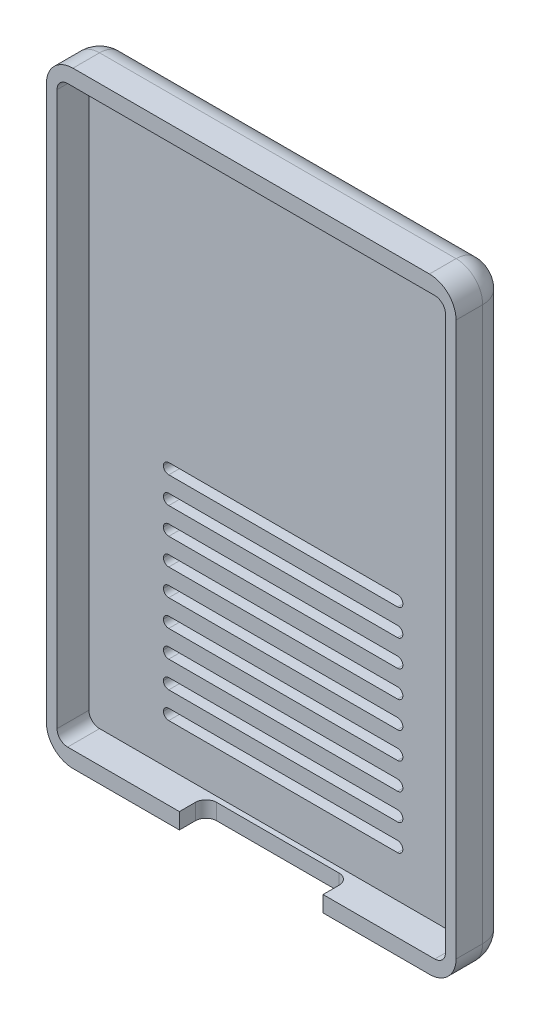
from build123d import *

# Parameters (mm, degrees)
SKETCH5_W           = 77
SKETCH5_H           = 114
BOSS_EXTRUDE3_DEPTH = 10
SKETCH7_W           = 73
SKETCH7_H           = 108
CUT_EXTRUDE5_DEPTH  = 6
FILLET3_R           = 5
FILLET4_R           = 5
FILLET5_R           = 2
SKETCH8_W           = 27
SKETCH8_H           = 5
CUT_EXTRUDE6_DEPTH  = 6
FILLET6_R           = 2
CUT_EXTRUDE7_DEPTH  = 1
SKETCH10_W          = 45
SKETCH10_H          = 2
CUT_EXTRUDE8_DEPTH  = 10
FILLET7_R           = 1


# Some blends are built 0.0001 mm under size
with BuildPart() as part:
    # Sketch5 → Boss-Extrude3 (new body)
    with BuildSketch(Plane.XY):
        with Locations((38.5, 53.537037037)):
            Rectangle(SKETCH5_W, SKETCH5_H)
    extrude(amount=BOSS_EXTRUDE3_DEPTH)

    # Sketch7 → Cut-Extrude5 (cut)
    with BuildSketch(Plane.XY.offset(10)):
        with Locations((38.5, 53.537037037)):
            Rectangle(SKETCH7_W, SKETCH7_H)
    extrude(amount=-CUT_EXTRUDE5_DEPTH, mode=Mode.SUBTRACT)

    # Fillet3
    fillet3_edges = [part.edges().sort_by_distance(p)[0] for p in [
        (38.5, 110.537037037, 0),
        (77, 53.537037037, 0),
        (38.5, -3.462962963, 0),
        (0, 53.537037037, 0),
    ]]
    fillet(fillet3_edges, radius=FILLET3_R)

    # Fillet4
    # the kernel refuses this fillet: 5 mm, written as the material it takes off along each edge
    with BuildSketch(Plane(origin=(5, 105.537037037, 5), x_dir=(-1, 0, 0), z_dir=(0, 1, 0))) as fillet4_piece_1_section:
        Polygon((0, 0), (FILLET4_R, 0), (FILLET4_R, -FILLET4_R), (0, -FILLET4_R), align=None)
    fillet4_piece_1 = extrude(amount=FILLET4_R, mode=Mode.PRIVATE)
    fillet4_piece_1 = fillet4_piece_1 - Plane(origin=(5, 105.537037037, 5), x_dir=(0.7071067811865475, 0, 0.7071067811865475), z_dir=(0, 1, 0)) * Sphere(FILLET4_R, mode=Mode.PRIVATE)
    add(fillet4_piece_1, mode=Mode.SUBTRACT)
    with BuildSketch(Plane(origin=(72, 105.537037037, 5), x_dir=(1, 0, 0), z_dir=(0, 1, 0))) as fillet4_piece_2_section:
        Polygon((0, 0), (FILLET4_R, 0), (FILLET4_R, FILLET4_R), (0, FILLET4_R), align=None)
    fillet4_piece_2 = extrude(amount=FILLET4_R, mode=Mode.PRIVATE)
    fillet4_piece_2 = fillet4_piece_2 - Plane(origin=(72, 105.537037037, 5), x_dir=(-0.7071067811865475, 0, 0.7071067811865475), z_dir=(0, 1, 0)) * Sphere(FILLET4_R, mode=Mode.PRIVATE)
    add(fillet4_piece_2, mode=Mode.SUBTRACT)
    with BuildSketch(Plane(origin=(5, 1.537037037, 5), x_dir=(0, -1, 0), z_dir=(-1, 0, 0))) as fillet4_piece_3_section:
        Polygon((0, 0), (FILLET4_R, 0), (FILLET4_R, -FILLET4_R), (0, -FILLET4_R), align=None)
    fillet4_piece_3 = extrude(amount=FILLET4_R, mode=Mode.PRIVATE)
    fillet4_piece_3 = fillet4_piece_3 - Plane(origin=(5, 1.537037037, 5), x_dir=(0, 0.7071067811865475, 0.7071067811865475), z_dir=(-1, 0, 0)) * Sphere(FILLET4_R, mode=Mode.PRIVATE)
    add(fillet4_piece_3, mode=Mode.SUBTRACT)
    with BuildSketch(Plane(origin=(72, 1.537037037, 5), x_dir=(0, -1, 0), z_dir=(1, 0, 0))) as fillet4_piece_4_section:
        Polygon((0, 0), (FILLET4_R, 0), (FILLET4_R, FILLET4_R), (0, FILLET4_R), align=None)
    fillet4_piece_4 = extrude(amount=FILLET4_R, mode=Mode.PRIVATE)
    fillet4_piece_4 = fillet4_piece_4 - Plane(origin=(72, 1.537037037, 5), x_dir=(0, 0.7071067811865475, 0.7071067811865475), z_dir=(1, 0, 0)) * Sphere(FILLET4_R, mode=Mode.PRIVATE)
    add(fillet4_piece_4, mode=Mode.SUBTRACT)
    with BuildSketch(Plane(origin=(0, 110.537037037, 5), x_dir=(1, 0, 0), z_dir=(0, 0, 1)), Plane(origin=(0, -3.462962963, 5), x_dir=(0, 1, 0), z_dir=(0, 0, 1))) as fillet4_piece_5:
        with BuildLine():
            CenterArc((FILLET4_R, -FILLET4_R), FILLET4_R, 90, 90)
            Line((0, -FILLET4_R), (0, 0))
            Line((0, 0), (FILLET4_R, 0))
        make_face()
    extrude(amount=17.5, mode=Mode.SUBTRACT)
    with BuildSketch(Plane(origin=(77, 110.537037037, 5), x_dir=(-1, 0, 0), z_dir=(0, 0, 1)), Plane(origin=(77, -3.462962963, 5), x_dir=(0, 1, 0), z_dir=(0, 0, 1))) as fillet4_piece_6:
        with BuildLine():
            CenterArc((FILLET4_R, FILLET4_R), FILLET4_R, 180, 90)
            Line((0, FILLET4_R), (0, 0))
            Line((0, 0), (FILLET4_R, 0))
        make_face()
    extrude(amount=17.5, mode=Mode.SUBTRACT)

    # Fillet5
    fillet5_edges = [part.edges().sort_by_distance(p)[0] for p in [
        (2, -0.462962963, 7),
        (2, 107.537037037, 7),
        (75, 107.537037037, 7),
        (75, -0.462962963, 7),
    ]]
    fillet(fillet5_edges, radius=FILLET5_R)

    # Sketch8 → Cut-Extrude6 (cut)
    with BuildSketch(Plane.XZ.offset(3.462962963)):
        with Locations((38.5, 7.5)):
            Rectangle(SKETCH8_W, SKETCH8_H)
    extrude(amount=-CUT_EXTRUDE6_DEPTH, mode=Mode.SUBTRACT)

    # Fillet6
    fillet6_edges = [part.edges().sort_by_distance(p)[0] for p in [
        (52, -1.962962963, 5),
        (25, -1.962962963, 5),
    ]]
    fillet(fillet6_edges, radius=FILLET6_R)

    # Sketch9 → Cut-Extrude7 (cut)
    # profile 1 of 10: a face of its own
    with BuildSketch(Plane(origin=(0, 0, 0), x_dir=(-1, 0, 0), z_dir=(0, 0, -1))):
        with BuildLine():
            Line((-53.6891973, 69.235203081), (-53.053179672, 69.235203081))
            add(Edge.make_bspline(
                [(-53.053179672, 69.235203081), (-53.011623105, 69.235017065), (-52.931451777, 69.234658201), (-52.815838126, 69.230306499), (-52.709178872, 69.222507983), (-52.611498521, 69.21287025), (-52.522837235, 69.199358525), (-52.443083984, 69.183868389), (-52.372222217, 69.164996895), (-52.309452864, 69.142596694), (-52.253119396, 69.116187732), (-52.199809767, 69.088060302), (-52.150728779, 69.054491206), (-52.103399167, 69.019098379), (-52.060526846, 68.978500759), (-52.019437185, 68.935400174), (-51.981870442, 68.888087292), (-51.947652548, 68.837134823), (-51.916611645, 68.783484149), (-51.889492235, 68.72703936), (-51.867494489, 68.667711138), (-51.849041115, 68.605883268), (-51.834219186, 68.541558446), (-51.824353238, 68.474341068), (-51.817651789, 68.404700471), (-51.817060479, 68.357303037), (-51.816761403, 68.333330084)],
                knots=[0, 0, 0, 0, 1.698747864, 3.27724071, 4.728299578, 6.070144658, 7.288476769, 8.393259625, 9.389771311, 10.283485332, 11.113357557, 11.931608583, 12.74405601, 13.541433047, 14.344816069, 15.154114104, 15.974336324, 16.810834471, 17.661136416, 18.50621059, 19.367396281, 20.244825668, 21.142564693, 22.063065223, 23.020325768, 24, 24, 24, 24], degree=3))
            add(Edge.make_bspline(
                [(-51.816761403, 68.333330084), (-51.817194129, 68.306809378), (-51.818044489, 68.254692931), (-51.826380756, 68.178296614), (-51.840621735, 68.105459642), (-51.85923395, 68.035567769), (-51.885187359, 67.96977087), (-51.914837911, 67.906499012), (-51.951317494, 67.847526143), (-51.99300125, 67.792114583), (-52.038524666, 67.739813811), (-52.088968468, 67.692133912), (-52.143371174, 67.648749854), (-52.201417867, 67.609206969), (-52.263326471, 67.573585023), (-52.329052316, 67.541550455), (-52.399044216, 67.51412783), (-52.447784469, 67.499786019), (-52.472495577, 67.49251478)],
                knots=[0, 0, 0, 0, 1.102006807, 2.165578795, 3.188629044, 4.184801286, 5.166646146, 6.124351954, 7.085497154, 8.042432466, 9.003981491, 9.963833307, 10.922997304, 11.89326795, 12.880200226, 13.889073926, 14.929769137, 16, 16, 16, 16], degree=3))
            add(Edge.make_bspline(
                [(-52.472495577, 67.49251478), (-52.488771735, 67.488465246), (-52.524031133, 67.47969265), (-52.582375753, 67.470786264), (-52.649611802, 67.46259739), (-52.725956697, 67.455560043), (-52.811454454, 67.450776288), (-52.906022288, 67.447040387), (-53.009703056, 67.444324002), (-53.081798562, 67.444227612), (-53.119325505, 67.44417744)],
                knots=[0, 0, 0, 0, 0.618981996, 1.340914327, 2.176866532, 3.120127938, 4.170906482, 5.338178032, 6.614476169, 8, 8, 8, 8], degree=3))
            Line((-53.119325505, 67.44417744), (-53.119325505, 66.060203081))
            Line((-53.119325505, 66.060203081), (-53.6891973, 66.060203081))
            Line((-53.6891973, 66.060203081), (-53.6891973, 69.235203081))
        make_face()
        with BuildLine():
            Line((-53.119325505, 68.014049235), (-52.917707917, 68.014049235))
            add(Edge.make_bspline(
                [(-52.917707917, 68.014049235), (-52.881020414, 68.014281862), (-52.813514863, 68.0147099), (-52.721326119, 68.020899572), (-52.64724147, 68.030352452), (-52.588713223, 68.043910068), (-52.542499627, 68.064485546), (-52.502643295, 68.088287498), (-52.468457501, 68.118384414), (-52.438857635, 68.15277529), (-52.415193434, 68.192292131), (-52.398783543, 68.23629148), (-52.388124001, 68.283848866), (-52.387139493, 68.316945658), (-52.386633198, 68.333966102)],
                knots=[0, 0, 0, 0, 1.8619151, 3.425951444, 4.686033666, 5.651700536, 6.461346321, 7.243864085, 7.999046032, 8.762387399, 9.539336099, 10.322741239, 11.137448474, 12, 12, 12, 12], degree=3))
            add(Edge.make_bspline(
                [(-52.386633198, 68.333966102), (-52.387134285, 68.348836642), (-52.388106516, 68.377689066), (-52.395248785, 68.41933027), (-52.406631508, 68.458148462), (-52.423124637, 68.493738237), (-52.444446346, 68.526039124), (-52.470441825, 68.555038397), (-52.5007775, 68.581357101), (-52.524198415, 68.595287993), (-52.53609734, 68.602365541)],
                knots=[0, 0, 0, 0, 1.102301479, 2.1387299, 3.123554645, 4.094223062, 5.036071848, 5.982632524, 6.975082478, 8, 8, 8, 8], degree=3))
            add(Edge.make_bspline(
                [(-52.53609734, 68.602365541), (-52.546176417, 68.607462819), (-52.567515889, 68.618254802), (-52.603859077, 68.630801271), (-52.645798562, 68.641385599), (-52.693617481, 68.65017049), (-52.747125072, 68.656988477), (-52.806311788, 68.662202532), (-52.871264727, 68.664299306), (-52.91643561, 68.664977805), (-52.939968534, 68.665331286)],
                knots=[0, 0, 0, 0, 0.656809284, 1.390599849, 2.23162475, 3.173112763, 4.218524733, 5.370385145, 6.63003504, 8, 8, 8, 8], degree=3))
            Line((-52.939968534, 68.665331286), (-53.119325505, 68.665331286))
            Line((-53.119325505, 68.665331286), (-53.119325505, 68.014049235))
        make_face(mode=Mode.SUBTRACT)
    # profile 2 of 10: a face of its own
    with BuildSketch(Plane(origin=(0, 0, 0), x_dir=(-1, 0, 0), z_dir=(0, 0, -1))):
        with BuildLine():
            add(Edge.make_bspline(
                [(-49.754792252, 69.316613338), (-49.699590986, 69.315184078), (-49.590611184, 69.312362396), (-49.430341221, 69.288841472), (-49.275891479, 69.250517499), (-49.127331798, 69.197244404), (-48.985034155, 69.127579282), (-48.848496618, 69.043497184), (-48.718208259, 68.943411112), (-48.595504168, 68.829655907), (-48.482103458, 68.705952089), (-48.383841676, 68.572762936), (-48.300047633, 68.433539513), (-48.230598907, 68.287908767), (-48.177700775, 68.134862135), (-48.140579967, 67.975179953), (-48.116731688, 67.808907649), (-48.113988769, 67.695698872), (-48.112594736, 67.638162817)],
                knots=[0, 0, 0, 0, 1.014329547, 2.002516266, 2.970391464, 3.935626869, 4.897733899, 5.877609409, 6.878433252, 7.912639331, 8.949961323, 9.958554974, 10.949718813, 11.932905612, 12.9188844, 13.919928257, 14.942845884, 16, 16, 16, 16], degree=3))
            add(Edge.make_bspline(
                [(-48.112594736, 67.638162817), (-48.114079321, 67.58127506), (-48.117004742, 67.469175909), (-48.139606376, 67.304435869), (-48.177352302, 67.146464216), (-48.229353241, 66.994903376), (-48.29754243, 66.850487459), (-48.379702397, 66.712294389), (-48.478001188, 66.581606631), (-48.58885346, 66.458494316), (-48.710892191, 66.346743473), (-48.84015058, 66.248263236), (-48.976031793, 66.1648148), (-49.118336942, 66.096436387), (-49.267371194, 66.043370419), (-49.422766416, 66.005928523), (-49.584512992, 65.983174327), (-49.694508508, 65.980268014), (-49.750340129, 65.978792825)],
                knots=[0, 0, 0, 0, 1.051557043, 2.072126891, 3.067553643, 4.050577992, 5.02905126, 6.015227836, 7.017913613, 8.04756643, 9.074058332, 10.072836633, 11.047628519, 12.017157415, 12.98668631, 13.966869689, 14.968021931, 16, 16, 16, 16], degree=3))
            add(Edge.make_bspline(
                [(-49.750340129, 65.978792825), (-49.808733309, 65.980116142), (-49.923467927, 65.982716279), (-50.091382555, 66.007442399), (-50.252259277, 66.044688572), (-50.404746636, 66.100276487), (-50.550397587, 66.169766055), (-50.688141988, 66.255346624), (-50.817933549, 66.356876767), (-50.939027764, 66.471756257), (-51.048739416, 66.597459616), (-51.145581469, 66.730254067), (-51.227269889, 66.869125179), (-51.293807664, 67.014137945), (-51.346263374, 67.164391146), (-51.383264917, 67.320799867), (-51.405122611, 67.482988985), (-51.408167261, 67.593151075), (-51.409710121, 67.648975116)],
                knots=[0, 0, 0, 0, 1.067978421, 2.098431617, 3.099715153, 4.085208694, 5.062210972, 6.048429807, 7.046490867, 8.072918869, 9.098532598, 10.095778865, 11.076610158, 12.041847152, 13.011192615, 13.984257998, 14.978533688, 16, 16, 16, 16], degree=3))
            add(Edge.make_bspline(
                [(-51.409710121, 67.648975116), (-51.409225882, 67.686530609), (-51.408263537, 67.761166055), (-51.396671078, 67.871771977), (-51.379981269, 67.98021902), (-51.355297835, 68.086074803), (-51.32531377, 68.190086091), (-51.286465179, 68.29128472), (-51.242244968, 68.390751771), (-51.190577816, 68.487312412), (-51.133128939, 68.580078205), (-51.070447099, 68.668611558), (-51.002374683, 68.751841973), (-50.929130976, 68.830316406), (-50.85046357, 68.903519039), (-50.767407253, 68.972486157), (-50.678351216, 69.035385749), (-50.585244617, 69.093753947), (-50.488612369, 69.146535296), (-50.388847853, 69.191461202), (-50.288006415, 69.23069423), (-50.18474095, 69.261658671), (-50.08015813, 69.286878884), (-49.9731407, 69.303557443), (-49.864655502, 69.315149582), (-49.791500245, 69.316124261), (-49.754792252, 69.316613338)],
                knots=[0, 0, 0, 0, 1.034744296, 2.056386356, 3.06226378, 4.057406941, 5.050368692, 6.043467995, 7.042652155, 8.049140477, 9.059438543, 10.048523776, 11.036952808, 12.020949711, 13.004946614, 13.997082645, 14.994316842, 16.007702937, 17.024872941, 18.026463647, 19.021641123, 20.005082605, 20.995858141, 21.984425357, 22.988620895, 24, 24, 24, 24], degree=3))
        make_face()
        with BuildLine():
            add(Edge.make_bspline(
                [(-49.763696499, 68.746741543), (-49.800846944, 68.745744713), (-49.874167056, 68.74377737), (-49.981714307, 68.728788875), (-50.084963466, 68.704850546), (-50.183342182, 68.670176168), (-50.277276838, 68.626044486), (-50.366933949, 68.572609701), (-50.451071951, 68.508035051), (-50.530812742, 68.435787262), (-50.602845425, 68.355286622), (-50.666488573, 68.269016495), (-50.719747637, 68.177120952), (-50.764352437, 68.08045368), (-50.797929965, 67.977927681), (-50.821846232, 67.870346053), (-50.83696042, 67.757523427), (-50.838865582, 67.680612389), (-50.839838326, 67.641342905)],
                knots=[0, 0, 0, 0, 1.033739768, 2.040188636, 3.016340934, 3.979330865, 4.937572243, 5.900995986, 6.878200029, 7.884839167, 8.891893314, 9.879764717, 10.863503415, 11.843163062, 12.837761627, 13.859916423, 14.907309254, 16, 16, 16, 16], degree=3))
            add(Edge.make_bspline(
                [(-50.839838326, 67.641342905), (-50.838548616, 67.597823483), (-50.836020999, 67.512532626), (-50.818236375, 67.388112621), (-50.787808653, 67.270610276), (-50.743871615, 67.160600276), (-50.689378161, 67.056861043), (-50.621705939, 66.960664048), (-50.54195092, 66.871433309), (-50.4805083, 66.819336686), (-50.449323502, 66.792895389)],
                knots=[0, 0, 0, 0, 1.078454662, 2.113592447, 3.107694534, 4.079536787, 5.043276885, 6.005368276, 6.987637804, 8, 8, 8, 8], degree=3))
            add(Edge.make_bspline(
                [(-50.449323502, 66.792895389), (-50.423777199, 66.773361574), (-50.373260157, 66.734734044), (-50.292623958, 66.68522494), (-50.209584551, 66.642790699), (-50.1235153, 66.608504334), (-50.034597979, 66.581535256), (-49.94284478, 66.562649254), (-49.84838571, 66.550796655), (-49.78450806, 66.549380045), (-49.752248182, 66.54866462)],
                knots=[0, 0, 0, 0, 1.023928204, 2.024787132, 3.009472467, 3.9914905, 4.972207045, 5.96565515, 6.972602802, 8, 8, 8, 8], degree=3))
            add(Edge.make_bspline(
                [(-49.752248182, 66.54866462), (-49.71573654, 66.549669902), (-49.643898736, 66.551647825), (-49.538353534, 66.566451803), (-49.437238026, 66.591505479), (-49.339924477, 66.62587568), (-49.246693496, 66.670561474), (-49.158000728, 66.725653639), (-49.07369067, 66.790475714), (-48.994051468, 66.863672274), (-48.921257472, 66.944490032), (-48.857747134, 67.031220314), (-48.802794698, 67.121952194), (-48.759117456, 67.217969845), (-48.724213355, 67.318366903), (-48.700584933, 67.423588007), (-48.685343065, 67.533199394), (-48.683437366, 67.607793817), (-48.682466531, 67.645795028)],
                knots=[0, 0, 0, 0, 1.026359118, 2.019393844, 2.989460624, 3.950973911, 4.916101784, 5.890408035, 6.881132271, 7.902007068, 8.92769091, 9.933912415, 10.920395702, 11.90457117, 12.894218921, 13.903490204, 14.931958862, 16, 16, 16, 16], degree=3))
            add(Edge.make_bspline(
                [(-48.682466531, 67.645795028), (-48.683470957, 67.683577722), (-48.685448016, 67.757947193), (-48.70027805, 67.867276771), (-48.725172841, 67.972033354), (-48.759646253, 68.072388022), (-48.803666974, 68.168439159), (-48.858103062, 68.259848993), (-48.922763507, 68.346529153), (-48.996160152, 68.427888946), (-49.076047889, 68.502653385), (-49.161815357, 68.567535327), (-49.251062687, 68.623915671), (-49.345837646, 68.668081757), (-49.444201219, 68.703268783), (-49.546753626, 68.729181014), (-49.65388329, 68.743672075), (-49.726765815, 68.745709267), (-49.763696499, 68.746741543)],
                knots=[0, 0, 0, 0, 1.055025985, 2.07665775, 3.074803781, 4.057872707, 5.035505728, 6.020516407, 7.023567878, 8.050795229, 9.077271434, 10.074415901, 11.050397877, 12.019801805, 12.988065821, 13.964604439, 14.968634123, 16, 16, 16, 16], degree=3))
        make_face(mode=Mode.SUBTRACT)
    # profile 3 of 10: a face of its own
    with BuildSketch(Plane(origin=(0, 0, 0), x_dir=(-1, 0, 0), z_dir=(0, 0, -1))):
        with BuildLine():
            Line((-44.693363967, 68.684411815), (-45.111227549, 68.284992745))
            add(Edge.make_bspline(
                [(-45.111227549, 68.284992745), (-45.146674142, 68.321644582), (-45.215912444, 68.393237102), (-45.327481404, 68.488019289), (-45.44350906, 68.567007417), (-45.561738326, 68.633530716), (-45.684295804, 68.683860333), (-45.809764394, 68.720536373), (-45.938945252, 68.742896368), (-46.026369888, 68.745454747), (-46.070342132, 68.746741543)],
                knots=[0, 0, 0, 0, 1.115251505, 2.178435587, 3.19620269, 4.182487026, 5.141301733, 6.088180966, 7.038406374, 8, 8, 8, 8], degree=3))
            add(Edge.make_bspline(
                [(-46.070342132, 68.746741543), (-46.107064299, 68.745724929), (-46.17953145, 68.743718754), (-46.285932218, 68.729011509), (-46.387710051, 68.704001201), (-46.485213352, 68.669532362), (-46.578155212, 68.624931515), (-46.666730495, 68.570233178), (-46.750720824, 68.505931356), (-46.829016734, 68.432358749), (-46.900639081, 68.351975147), (-46.963921985, 68.266206036), (-47.016931568, 68.175247907), (-47.06043567, 68.080021919), (-47.094323685, 67.980087316), (-47.118523984, 67.875511381), (-47.132520791, 67.76616957), (-47.134609908, 67.691839822), (-47.135671659, 67.654063258)],
                knots=[0, 0, 0, 0, 1.035432265, 2.043311493, 3.022114605, 3.98653278, 4.95457646, 5.923598177, 6.917315552, 7.932509744, 8.948865224, 9.949768934, 10.933144597, 11.912367597, 12.897413939, 13.903909035, 14.934704909, 16, 16, 16, 16], degree=3))
            add(Edge.make_bspline(
                [(-47.135671659, 67.654063258), (-47.135365675, 67.627549021), (-47.134762573, 67.575288917), (-47.128160558, 67.497981718), (-47.117529758, 67.42297546), (-47.102144357, 67.350383755), (-47.08290476, 67.280143696), (-47.060332333, 67.211649325), (-47.032015556, 67.14584708), (-47.000583505, 67.081972711), (-46.964028393, 67.021769109), (-46.924615238, 66.964359979), (-46.881878107, 66.910026734), (-46.835540187, 66.858991489), (-46.784949332, 66.812051812), (-46.731413127, 66.76779617), (-46.67402849, 66.727332432), (-46.613987447, 66.689645116), (-46.550771317, 66.656905825), (-46.486095302, 66.627250351), (-46.418978782, 66.603165698), (-46.350238942, 66.58375127), (-46.280121433, 66.567242198), (-46.207940441, 66.557077056), (-46.134321685, 66.549379112), (-46.084567763, 66.548903809), (-46.059529832, 66.54866462)],
                knots=[0, 0, 0, 0, 1.103660481, 2.175337485, 3.227646561, 4.255952547, 5.262355991, 6.258840057, 7.255597736, 8.242457506, 9.22035537, 10.185017736, 11.140346927, 12.096287581, 13.051739095, 14.01125915, 14.986044842, 15.97314143, 16.960198552, 17.947847494, 18.933482797, 19.925264591, 20.920966487, 21.929612487, 22.958107872, 24, 24, 24, 24], degree=3))
            add(Edge.make_bspline(
                [(-46.059529832, 66.54866462), (-46.017061198, 66.549893038), (-45.933621376, 66.55230656), (-45.81116144, 66.571179964), (-45.69446932, 66.602225645), (-45.601232875, 66.638888791), (-45.528184583, 66.675094123), (-45.472573998, 66.708582273), (-45.415068319, 66.746042444), (-45.356622666, 66.788888426), (-45.296579641, 66.836606049), (-45.235999143, 66.890240418), (-45.173330299, 66.94802543), (-45.13227656, 66.989267728), (-45.111227549, 67.010413418)],
                knots=[0, 0, 0, 0, 1.404581149, 2.759636711, 4.088442092, 5.392261763, 6.066678138, 6.783632037, 7.538459478, 8.336747902, 9.180226004, 10.074962426, 11.012997595, 12, 12, 12, 12], degree=3))
            Line((-45.111227549, 67.010413418), (-44.706084319, 66.584917625))
            add(Edge.make_bspline(
                [(-44.706084319, 66.584917625), (-44.734563708, 66.557421669), (-44.790149383, 66.503755445), (-44.873998831, 66.427554414), (-44.957742752, 66.359079316), (-45.039358066, 66.295844807), (-45.120181717, 66.23969306), (-45.200205135, 66.190567996), (-45.278522419, 66.147227172), (-45.356759852, 66.110401508), (-45.435404269, 66.079132695), (-45.516320132, 66.0522123), (-45.599754808, 66.029438614), (-45.686217879, 66.01106324), (-45.77490287, 65.996328671), (-45.866639754, 65.986382922), (-45.960846874, 65.979696726), (-46.024749023, 65.979095916), (-46.056985762, 65.978792825)],
                knots=[0, 0, 0, 0, 1.244526981, 2.429050516, 3.560637417, 4.644440555, 5.67424972, 6.652764056, 7.595344123, 8.486817594, 9.369275933, 10.254498637, 11.166417451, 12.086725134, 13.032340136, 13.991389299, 14.986715468, 16, 16, 16, 16], degree=3))
            add(Edge.make_bspline(
                [(-46.056985762, 65.978792825), (-46.116200658, 65.980302331), (-46.232067751, 65.983256014), (-46.401867955, 66.005140807), (-46.56317359, 66.041830277), (-46.716377083, 66.093719308), (-46.86142972, 66.160005113), (-46.998294391, 66.241268397), (-47.1267505, 66.337293257), (-47.245760376, 66.446954188), (-47.353410473, 66.56806548), (-47.448560692, 66.698105783), (-47.527268956, 66.837714195), (-47.592622124, 66.984828256), (-47.643727442, 67.140119303), (-47.679696922, 67.303755315), (-47.701879038, 67.475578291), (-47.704305793, 67.592937344), (-47.705543454, 67.652791222)],
                knots=[0, 0, 0, 0, 1.078019885, 2.10938526, 3.111377082, 4.085535484, 5.04941344, 6.010039228, 6.978205633, 7.964457913, 8.951525778, 9.924444315, 10.892603023, 11.863865945, 12.85144698, 13.863884204, 14.910567087, 16, 16, 16, 16], degree=3))
            add(Edge.make_bspline(
                [(-47.705543454, 67.652791222), (-47.705020479, 67.691827411), (-47.703984069, 67.769187597), (-47.693091309, 67.883145417), (-47.677906167, 67.994233909), (-47.653816321, 68.101299604), (-47.624778388, 68.205784875), (-47.588665902, 68.30655409), (-47.545536542, 68.403896869), (-47.496780467, 68.49797617), (-47.441623207, 68.588175673), (-47.380006492, 68.673720422), (-47.313516578, 68.755270806), (-47.240555819, 68.831744908), (-47.162184431, 68.903814186), (-47.078048576, 68.971088083), (-46.98865429, 69.034531382), (-46.893759615, 69.092508034), (-46.795208102, 69.144950998), (-46.694242744, 69.191207931), (-46.591111603, 69.229868076), (-46.486250726, 69.261935239), (-46.379217076, 69.285871109), (-46.270774634, 69.303989791), (-46.160000683, 69.31411825), (-46.085625572, 69.315776343), (-46.048081515, 69.316613338)],
                knots=[0, 0, 0, 0, 1.071919942, 2.124283339, 3.142214191, 4.149696895, 5.136002878, 6.119640489, 7.086990633, 8.058538607, 9.028339693, 9.988281803, 10.952401235, 11.916291999, 12.888973767, 13.874849856, 14.873389453, 15.898127285, 16.927174885, 17.938320013, 18.946391617, 19.950418109, 20.947802303, 21.956882652, 22.968648068, 24, 24, 24, 24], degree=3))
            add(Edge.make_bspline(
                [(-46.048081515, 69.316613338), (-46.016052585, 69.316133552), (-45.952327736, 69.315178968), (-45.857430742, 69.307221474), (-45.76329269, 69.29472431), (-45.670250623, 69.275868752), (-45.577639009, 69.253484821), (-45.486674869, 69.224176151), (-45.395923193, 69.191506116), (-45.306807286, 69.152455759), (-45.219202758, 69.109828767), (-45.13516188, 69.061466897), (-45.053273615, 69.010346284), (-44.975352558, 68.953441386), (-44.899939079, 68.892816249), (-44.827427523, 68.828188024), (-44.758454219, 68.758479168), (-44.715170404, 68.709225747), (-44.693363967, 68.684411815)],
                knots=[0, 0, 0, 0, 0.996412454, 1.982464992, 2.961075852, 3.949442424, 4.934965278, 5.923860011, 6.921385422, 7.934793307, 8.949617135, 9.951082467, 10.950285876, 11.951772932, 12.951063433, 13.960125323, 14.972308753, 16, 16, 16, 16], degree=3))
        make_face()
    # profile 4 of 10: a face of its own
    with BuildSketch(Plane(origin=(0, 0, 0), x_dir=(-1, 0, 0), z_dir=(0, 0, -1))):
        Polygon((-44.123492172, 69.235203081), (-43.553620377, 69.235203081), (-43.553620377, 68.117720108), (-42.653019416, 69.235203081), (-41.933683478, 69.235203081), (-43.065158839, 67.830876158), (-41.823652428, 66.060203081), (-42.509915449, 66.060203081), (-43.553620377, 67.549120349), (-43.553620377, 66.060203081), (-44.123492172, 66.060203081), align=None)
    # profile 5 of 10: a face of its own
    with BuildSketch(Plane(origin=(0, 0, 0), x_dir=(-1, 0, 0), z_dir=(0, 0, -1))):
        Polygon((-41.396248582, 69.235203081), (-39.686633198, 69.235203081), (-39.686633198, 68.665331286), (-40.826376787, 68.665331286), (-40.826376787, 68.054754363), (-39.686633198, 68.054754363), (-39.686633198, 67.484882568), (-40.826376787, 67.484882568), (-40.826376787, 66.630074876), (-39.686633198, 66.630074876), (-39.686633198, 66.060203081), (-41.396248582, 66.060203081), align=None)
    # profile 6 of 10: a face of its own
    with BuildSketch(Plane(origin=(0, 0, 0), x_dir=(-1, 0, 0), z_dir=(0, 0, -1))):
        Polygon((-39.442402428, 69.235203081), (-37.732787044, 69.235203081), (-37.732787044, 68.665331286), (-38.302658839, 68.665331286), (-38.302658839, 66.060203081), (-38.872530634, 66.060203081), (-38.872530634, 68.665331286), (-39.442402428, 68.665331286), align=None)
    # profile 7 of 10: a face of its own
    with BuildSketch(Plane(origin=(0, 0, 0), x_dir=(-1, 0, 0), z_dir=(0, 0, -1))):
        with BuildLine():
            Line((-33.214517813, 68.684411815), (-33.632381395, 68.284992745))
            add(Edge.make_bspline(
                [(-33.632381395, 68.284992745), (-33.667827988, 68.321644582), (-33.73706629, 68.393237102), (-33.84863525, 68.488019289), (-33.964662906, 68.567007417), (-34.082892172, 68.633530716), (-34.20544965, 68.683860333), (-34.33091824, 68.720536373), (-34.460099098, 68.742896368), (-34.547523734, 68.745454747), (-34.591495978, 68.746741543)],
                knots=[0, 0, 0, 0, 1.115251505, 2.178435587, 3.19620269, 4.182487026, 5.141301733, 6.088180966, 7.038406374, 8, 8, 8, 8], degree=3))
            add(Edge.make_bspline(
                [(-34.591495978, 68.746741543), (-34.628218145, 68.745724929), (-34.700685296, 68.743718754), (-34.807086064, 68.729011509), (-34.908863897, 68.704001201), (-35.006367198, 68.669532362), (-35.099309058, 68.624931515), (-35.187884341, 68.570233178), (-35.27187467, 68.505931356), (-35.35017058, 68.432358749), (-35.421792927, 68.351975147), (-35.485075831, 68.266206036), (-35.538085414, 68.175247907), (-35.581589517, 68.080021919), (-35.615477531, 67.980087316), (-35.639677831, 67.875511381), (-35.653674637, 67.76616957), (-35.655763754, 67.691839822), (-35.656825505, 67.654063258)],
                knots=[0, 0, 0, 0, 1.035432265, 2.043311493, 3.022114605, 3.98653278, 4.95457646, 5.923598177, 6.917315552, 7.932509744, 8.948865224, 9.949768934, 10.933144597, 11.912367597, 12.897413939, 13.903909035, 14.934704909, 16, 16, 16, 16], degree=3))
            add(Edge.make_bspline(
                [(-35.656825505, 67.654063258), (-35.656519521, 67.627549021), (-35.655916419, 67.575288917), (-35.649314405, 67.497981718), (-35.638683604, 67.42297546), (-35.623298203, 67.350383755), (-35.604058607, 67.280143696), (-35.58148618, 67.211649325), (-35.553169402, 67.14584708), (-35.521737351, 67.081972711), (-35.485182239, 67.021769109), (-35.445769084, 66.964359979), (-35.403031953, 66.910026734), (-35.356694034, 66.858991489), (-35.306103178, 66.812051812), (-35.252566973, 66.76779617), (-35.195182337, 66.727332432), (-35.135141293, 66.689645116), (-35.071925163, 66.656905825), (-35.007249148, 66.627250351), (-34.940132628, 66.603165698), (-34.871392788, 66.58375127), (-34.801275279, 66.567242198), (-34.729094287, 66.557077056), (-34.655475532, 66.549379112), (-34.605721609, 66.548903809), (-34.580683678, 66.54866462)],
                knots=[0, 0, 0, 0, 1.103660481, 2.175337485, 3.227646561, 4.255952547, 5.262355991, 6.258840057, 7.255597736, 8.242457506, 9.22035537, 10.185017736, 11.140346927, 12.096287581, 13.051739095, 14.01125915, 14.986044842, 15.97314143, 16.960198552, 17.947847494, 18.933482797, 19.925264591, 20.920966487, 21.929612487, 22.958107872, 24, 24, 24, 24], degree=3))
            add(Edge.make_bspline(
                [(-34.580683678, 66.54866462), (-34.538215044, 66.549893038), (-34.454775222, 66.55230656), (-34.332315286, 66.571179964), (-34.215623166, 66.602225645), (-34.122386721, 66.638888791), (-34.049338429, 66.675094123), (-33.993727844, 66.708582273), (-33.936222165, 66.746042444), (-33.877776512, 66.788888426), (-33.817733487, 66.836606049), (-33.757152989, 66.890240418), (-33.694484145, 66.94802543), (-33.653430407, 66.989267728), (-33.632381395, 67.010413418)],
                knots=[0, 0, 0, 0, 1.404581149, 2.759636711, 4.088442092, 5.392261763, 6.066678138, 6.783632037, 7.538459478, 8.336747902, 9.180226004, 10.074962426, 11.012997595, 12, 12, 12, 12], degree=3))
            Line((-33.632381395, 67.010413418), (-33.227238166, 66.584917625))
            add(Edge.make_bspline(
                [(-33.227238166, 66.584917625), (-33.255717554, 66.557421669), (-33.311303229, 66.503755445), (-33.395152678, 66.427554414), (-33.478896598, 66.359079316), (-33.560511912, 66.295844807), (-33.641335563, 66.23969306), (-33.721358981, 66.190567996), (-33.799676265, 66.147227172), (-33.877913698, 66.110401508), (-33.956558115, 66.079132695), (-34.037473978, 66.0522123), (-34.120908655, 66.029438614), (-34.207371725, 66.01106324), (-34.296056716, 65.996328671), (-34.3877936, 65.986382922), (-34.48200072, 65.979696726), (-34.545902869, 65.979095916), (-34.578139608, 65.978792825)],
                knots=[0, 0, 0, 0, 1.244526981, 2.429050516, 3.560637417, 4.644440555, 5.67424972, 6.652764056, 7.595344123, 8.486817594, 9.369275933, 10.254498637, 11.166417451, 12.086725134, 13.032340136, 13.991389299, 14.986715468, 16, 16, 16, 16], degree=3))
            add(Edge.make_bspline(
                [(-34.578139608, 65.978792825), (-34.637354504, 65.980302331), (-34.753221597, 65.983256014), (-34.923021801, 66.005140807), (-35.084327436, 66.041830277), (-35.23753093, 66.093719308), (-35.382583566, 66.160005113), (-35.519448237, 66.241268397), (-35.647904346, 66.337293257), (-35.766914222, 66.446954188), (-35.874564319, 66.56806548), (-35.969714538, 66.698105783), (-36.048422802, 66.837714195), (-36.113775971, 66.984828256), (-36.164881288, 67.140119303), (-36.200850769, 67.303755315), (-36.223032884, 67.475578291), (-36.225459639, 67.592937344), (-36.2266973, 67.652791222)],
                knots=[0, 0, 0, 0, 1.078019885, 2.10938526, 3.111377082, 4.085535484, 5.04941344, 6.010039228, 6.978205633, 7.964457913, 8.951525778, 9.924444315, 10.892603023, 11.863865945, 12.85144698, 13.863884204, 14.910567087, 16, 16, 16, 16], degree=3))
            add(Edge.make_bspline(
                [(-36.2266973, 67.652791222), (-36.226174325, 67.691827411), (-36.225137915, 67.769187597), (-36.214245155, 67.883145417), (-36.199060013, 67.994233909), (-36.174970167, 68.101299604), (-36.145932234, 68.205784875), (-36.109819749, 68.30655409), (-36.066690388, 68.403896869), (-36.017934313, 68.49797617), (-35.962777053, 68.588175673), (-35.901160338, 68.673720422), (-35.834670424, 68.755270806), (-35.761709665, 68.831744908), (-35.683338277, 68.903814186), (-35.599202422, 68.971088083), (-35.509808136, 69.034531382), (-35.414913461, 69.092508034), (-35.316361948, 69.144950998), (-35.21539659, 69.191207931), (-35.112265449, 69.229868076), (-35.007404572, 69.261935239), (-34.900370922, 69.285871109), (-34.79192848, 69.303989791), (-34.681154529, 69.31411825), (-34.606779418, 69.315776343), (-34.569235361, 69.316613338)],
                knots=[0, 0, 0, 0, 1.071919942, 2.124283339, 3.142214191, 4.149696895, 5.136002878, 6.119640489, 7.086990633, 8.058538607, 9.028339693, 9.988281803, 10.952401235, 11.916291999, 12.888973767, 13.874849856, 14.873389453, 15.898127285, 16.927174885, 17.938320013, 18.946391617, 19.950418109, 20.947802303, 21.956882652, 22.968648068, 24, 24, 24, 24], degree=3))
            add(Edge.make_bspline(
                [(-34.569235361, 69.316613338), (-34.537206431, 69.316133552), (-34.473481582, 69.315178968), (-34.378584588, 69.307221474), (-34.284446537, 69.29472431), (-34.19140447, 69.275868752), (-34.098792856, 69.253484821), (-34.007828715, 69.224176151), (-33.917077039, 69.191506116), (-33.827961133, 69.152455759), (-33.740356604, 69.109828767), (-33.656315726, 69.061466897), (-33.574427462, 69.010346284), (-33.496506404, 68.953441386), (-33.421092926, 68.892816249), (-33.348581369, 68.828188024), (-33.279608065, 68.758479168), (-33.23632425, 68.709225747), (-33.214517813, 68.684411815)],
                knots=[0, 0, 0, 0, 0.996412454, 1.982464992, 2.961075852, 3.949442424, 4.934965278, 5.923860011, 6.921385422, 7.934793307, 8.949617135, 9.951082467, 10.950285876, 11.951772932, 12.951063433, 13.960125323, 14.972308753, 16, 16, 16, 16], degree=3))
        make_face()
    # profile 8 of 10: a face of its own
    with BuildSketch(Plane(origin=(0, 0, 0), x_dir=(-1, 0, 0), z_dir=(0, 0, -1))):
        with BuildLine():
            add(Edge.make_bspline(
                [(-31.152548662, 69.316613338), (-31.097347396, 69.315184078), (-30.988367594, 69.312362396), (-30.828097632, 69.288841472), (-30.673647889, 69.250517499), (-30.525088208, 69.197244404), (-30.382790565, 69.127579282), (-30.246253028, 69.043497184), (-30.115964669, 68.943411112), (-29.993260578, 68.829655907), (-29.879859868, 68.705952089), (-29.781598086, 68.572762936), (-29.697804043, 68.433539513), (-29.628355317, 68.287908767), (-29.575457185, 68.134862135), (-29.538336378, 67.975179953), (-29.514488098, 67.808907649), (-29.511745179, 67.695698872), (-29.510351146, 67.638162817)],
                knots=[0, 0, 0, 0, 1.014329547, 2.002516266, 2.970391464, 3.935626869, 4.897733899, 5.877609409, 6.878433252, 7.912639331, 8.949961323, 9.958554974, 10.949718813, 11.932905612, 12.9188844, 13.919928257, 14.942845884, 16, 16, 16, 16], degree=3))
            add(Edge.make_bspline(
                [(-29.510351146, 67.638162817), (-29.511835731, 67.58127506), (-29.514761152, 67.469175909), (-29.537362787, 67.304435869), (-29.575108713, 67.146464216), (-29.627109651, 66.994903376), (-29.69529884, 66.850487459), (-29.777458808, 66.712294389), (-29.875757599, 66.581606631), (-29.98660987, 66.458494316), (-30.108648601, 66.346743473), (-30.237906991, 66.248263236), (-30.373788203, 66.1648148), (-30.516093352, 66.096436387), (-30.665127604, 66.043370419), (-30.820522826, 66.005928523), (-30.982269403, 65.983174327), (-31.092264918, 65.980268014), (-31.148096539, 65.978792825)],
                knots=[0, 0, 0, 0, 1.051557043, 2.072126891, 3.067553643, 4.050577992, 5.02905126, 6.015227836, 7.017913613, 8.04756643, 9.074058332, 10.072836633, 11.047628519, 12.017157415, 12.98668631, 13.966869689, 14.968021931, 16, 16, 16, 16], degree=3))
            add(Edge.make_bspline(
                [(-31.148096539, 65.978792825), (-31.20648972, 65.980116142), (-31.321224338, 65.982716279), (-31.489138965, 66.007442399), (-31.650015687, 66.044688572), (-31.802503047, 66.100276487), (-31.948153997, 66.169766055), (-32.085898399, 66.255346624), (-32.21568996, 66.356876767), (-32.336784174, 66.471756257), (-32.446495826, 66.597459616), (-32.543337879, 66.730254067), (-32.625026299, 66.869125179), (-32.691564074, 67.014137945), (-32.744019784, 67.164391146), (-32.781021327, 67.320799867), (-32.802879021, 67.482988985), (-32.805923671, 67.593151075), (-32.807466531, 67.648975116)],
                knots=[0, 0, 0, 0, 1.067978421, 2.098431617, 3.099715153, 4.085208694, 5.062210972, 6.048429807, 7.046490867, 8.072918869, 9.098532598, 10.095778865, 11.076610158, 12.041847152, 13.011192615, 13.984257998, 14.978533688, 16, 16, 16, 16], degree=3))
            add(Edge.make_bspline(
                [(-32.807466531, 67.648975116), (-32.806982293, 67.686530609), (-32.806019948, 67.761166055), (-32.794427488, 67.871771977), (-32.77773768, 67.98021902), (-32.753054245, 68.086074803), (-32.72307018, 68.190086091), (-32.684221589, 68.29128472), (-32.640001379, 68.390751771), (-32.588334226, 68.487312412), (-32.530885349, 68.580078205), (-32.468203509, 68.668611558), (-32.400131093, 68.751841973), (-32.326887386, 68.830316406), (-32.24821998, 68.903519039), (-32.165163663, 68.972486157), (-32.076107627, 69.035385749), (-31.983001027, 69.093753947), (-31.886368779, 69.146535296), (-31.786604263, 69.191461202), (-31.685762825, 69.23069423), (-31.58249736, 69.261658671), (-31.47791454, 69.286878884), (-31.37089711, 69.303557443), (-31.262411913, 69.315149582), (-31.189256655, 69.316124261), (-31.152548662, 69.316613338)],
                knots=[0, 0, 0, 0, 1.034744296, 2.056386356, 3.06226378, 4.057406941, 5.050368692, 6.043467995, 7.042652155, 8.049140477, 9.059438543, 10.048523776, 11.036952808, 12.020949711, 13.004946614, 13.997082645, 14.994316842, 16.007702937, 17.024872941, 18.026463647, 19.021641123, 20.005082605, 20.995858141, 21.984425357, 22.988620895, 24, 24, 24, 24], degree=3))
        make_face()
        with BuildLine():
            add(Edge.make_bspline(
                [(-31.161452909, 68.746741543), (-31.198603354, 68.745744713), (-31.271923466, 68.74377737), (-31.379470717, 68.728788875), (-31.482719876, 68.704850546), (-31.581098593, 68.670176168), (-31.675033248, 68.626044486), (-31.764690359, 68.572609701), (-31.848828361, 68.508035051), (-31.928569152, 68.435787262), (-32.000601835, 68.355286622), (-32.064244983, 68.269016495), (-32.117504047, 68.177120952), (-32.162108847, 68.08045368), (-32.195686376, 67.977927681), (-32.219602642, 67.870346053), (-32.23471683, 67.757523427), (-32.236621992, 67.680612389), (-32.237594736, 67.641342905)],
                knots=[0, 0, 0, 0, 1.033739768, 2.040188636, 3.016340934, 3.979330865, 4.937572243, 5.900995986, 6.878200029, 7.884839167, 8.891893314, 9.879764717, 10.863503415, 11.843163062, 12.837761627, 13.859916423, 14.907309254, 16, 16, 16, 16], degree=3))
            add(Edge.make_bspline(
                [(-32.237594736, 67.641342905), (-32.236305026, 67.597823483), (-32.233777409, 67.512532626), (-32.215992785, 67.388112621), (-32.185565063, 67.270610276), (-32.141628025, 67.160600276), (-32.087134571, 67.056861043), (-32.01946235, 66.960664048), (-31.93970733, 66.871433309), (-31.87826471, 66.819336686), (-31.847079912, 66.792895389)],
                knots=[0, 0, 0, 0, 1.078454662, 2.113592447, 3.107694534, 4.079536787, 5.043276885, 6.005368276, 6.987637804, 8, 8, 8, 8], degree=3))
            add(Edge.make_bspline(
                [(-31.847079912, 66.792895389), (-31.82153361, 66.773361574), (-31.771016567, 66.734734044), (-31.690380368, 66.68522494), (-31.607340962, 66.642790699), (-31.52127171, 66.608504334), (-31.432354389, 66.581535256), (-31.34060119, 66.562649254), (-31.24614212, 66.550796655), (-31.182264471, 66.549380045), (-31.150004592, 66.54866462)],
                knots=[0, 0, 0, 0, 1.023928204, 2.024787132, 3.009472467, 3.9914905, 4.972207045, 5.96565515, 6.972602802, 8, 8, 8, 8], degree=3))
            add(Edge.make_bspline(
                [(-31.150004592, 66.54866462), (-31.11349295, 66.549669902), (-31.041655146, 66.551647825), (-30.936109945, 66.566451803), (-30.834994436, 66.591505479), (-30.737680887, 66.62587568), (-30.644449906, 66.670561474), (-30.555757138, 66.725653639), (-30.47144708, 66.790475714), (-30.391807878, 66.863672274), (-30.319013882, 66.944490032), (-30.255503545, 67.031220314), (-30.200551108, 67.121952194), (-30.156873866, 67.217969845), (-30.121969765, 67.318366903), (-30.098341343, 67.423588007), (-30.083099475, 67.533199394), (-30.081193776, 67.607793817), (-30.080222941, 67.645795028)],
                knots=[0, 0, 0, 0, 1.026359118, 2.019393844, 2.989460624, 3.950973911, 4.916101784, 5.890408035, 6.881132271, 7.902007068, 8.92769091, 9.933912415, 10.920395702, 11.90457117, 12.894218921, 13.903490204, 14.931958862, 16, 16, 16, 16], degree=3))
            add(Edge.make_bspline(
                [(-30.080222941, 67.645795028), (-30.081227367, 67.683577722), (-30.083204426, 67.757947193), (-30.09803446, 67.867276771), (-30.122929252, 67.972033354), (-30.157402663, 68.072388022), (-30.201423385, 68.168439159), (-30.255859472, 68.259848993), (-30.320519917, 68.346529153), (-30.393916562, 68.427888946), (-30.473804299, 68.502653385), (-30.559571768, 68.567535327), (-30.648819097, 68.623915671), (-30.743594056, 68.668081757), (-30.84195763, 68.703268783), (-30.944510036, 68.729181014), (-31.0516397, 68.743672075), (-31.124522225, 68.745709267), (-31.161452909, 68.746741543)],
                knots=[0, 0, 0, 0, 1.055025985, 2.07665775, 3.074803781, 4.057872707, 5.035505728, 6.020516407, 7.023567878, 8.050795229, 9.077271434, 10.074415901, 11.050397877, 12.019801805, 12.988065821, 13.964604439, 14.968634123, 16, 16, 16, 16], degree=3))
        make_face(mode=Mode.SUBTRACT)
    # profile 9 of 10: a face of its own
    with BuildSketch(Plane(origin=(0, 0, 0), x_dir=(-1, 0, 0), z_dir=(0, 0, -1))):
        with BuildLine():
            Line((-28.940479351, 69.235203081), (-28.276476948, 69.235203081))
            add(Edge.make_bspline(
                [(-28.276476948, 69.235203081), (-28.232586591, 69.235047296), (-28.148173072, 69.234747676), (-28.026453387, 69.230020473), (-27.914637118, 69.223442183), (-27.81255871, 69.213403536), (-27.720261833, 69.200093505), (-27.637653986, 69.18440318), (-27.564737581, 69.166520692), (-27.500897671, 69.1442377), (-27.443285309, 69.119102823), (-27.389582578, 69.090222388), (-27.338604716, 69.057917989), (-27.290692454, 69.021339609), (-27.245429425, 68.981145284), (-27.202730236, 68.937294554), (-27.163198266, 68.889415584), (-27.1270783, 68.837810907), (-27.094157859, 68.783523971), (-27.065063093, 68.726480239), (-27.041403181, 68.66664004), (-27.020497113, 68.604868195), (-27.005439149, 68.540281664), (-26.994966556, 68.473509207), (-26.987298933, 68.404315778), (-26.986858081, 68.357308834), (-26.986633198, 68.333330084)],
                knots=[0, 0, 0, 0, 1.749336639, 3.364467119, 4.854658419, 6.213483162, 7.451590619, 8.570285859, 9.5643256, 10.440900261, 11.26203566, 12.067320669, 12.869050712, 13.665104639, 14.467235401, 15.27997916, 16.102287765, 16.939272006, 17.78853747, 18.631303466, 19.488103222, 20.351255419, 21.228522269, 22.127379805, 23.044756219, 24, 24, 24, 24], degree=3))
            add(Edge.make_bspline(
                [(-26.986633198, 68.333330084), (-26.987217363, 68.308301778), (-26.988362806, 68.259225832), (-26.994532782, 68.187137269), (-27.00580956, 68.118167975), (-27.022889881, 68.052519882), (-27.042521492, 67.989375925), (-27.068626499, 67.929901147), (-27.098088579, 67.873230576), (-27.13307983, 67.820165837), (-27.171481019, 67.769528257), (-27.216140794, 67.723257949), (-27.264165888, 67.67886806), (-27.318255966, 67.639139021), (-27.376026687, 67.601384498), (-27.438625894, 67.567168846), (-27.505645045, 67.535631963), (-27.552762826, 67.518044818), (-27.576857557, 67.509051238)],
                knots=[0, 0, 0, 0, 1.099860209, 2.156625411, 3.176576793, 4.16617041, 5.135385252, 6.078461593, 7.016046972, 7.938469504, 8.868247731, 9.803980173, 10.76021508, 11.73834243, 12.748633912, 13.790971185, 14.870363756, 16, 16, 16, 16], degree=3))
            Line((-27.576857557, 67.509051238), (-26.844165249, 66.060203081))
            Line((-26.844165249, 66.060203081), (-27.477638807, 66.060203081))
            Line((-27.477638807, 66.060203081), (-28.177258198, 67.44417744))
            Line((-28.177258198, 67.44417744), (-28.370607557, 67.44417744))
            Line((-28.370607557, 67.44417744), (-28.370607557, 66.060203081))
            Line((-28.370607557, 66.060203081), (-28.940479351, 66.060203081))
            Line((-28.940479351, 66.060203081), (-28.940479351, 69.235203081))
        make_face()
        with BuildLine():
            Line((-28.370607557, 68.014049235), (-28.148637404, 68.014049235))
            add(Edge.make_bspline(
                [(-28.148637404, 68.014049235), (-28.121499708, 68.014354878), (-28.069536851, 68.014940119), (-27.994807438, 68.017654707), (-27.926935308, 68.024195524), (-27.865628997, 68.032459602), (-27.810580016, 68.042001674), (-27.762279383, 68.055676042), (-27.719982859, 68.070328473), (-27.684191659, 68.088537644), (-27.653612481, 68.109245421), (-27.627209317, 68.13276997), (-27.605370115, 68.159996641), (-27.587395338, 68.190185529), (-27.573412915, 68.223603648), (-27.563206818, 68.259884143), (-27.557503119, 68.299440295), (-27.556846889, 68.326739426), (-27.556504992, 68.340962296)],
                knots=[0, 0, 0, 0, 1.688639943, 3.233382647, 4.650958383, 5.928841754, 7.082724185, 8.122798841, 9.049171256, 9.863274652, 10.613301712, 11.341792392, 12.054588806, 12.776240173, 13.521029143, 14.301969904, 15.115324896, 16, 16, 16, 16], degree=3))
            add(Edge.make_bspline(
                [(-27.556504992, 68.340962296), (-27.557151379, 68.35778899), (-27.558421085, 68.390841911), (-27.571020517, 68.438426528), (-27.591076091, 68.482469347), (-27.61856679, 68.522771372), (-27.653187751, 68.558102908), (-27.692918035, 68.589247939), (-27.738615118, 68.613875099), (-27.780927178, 68.630118912), (-27.819421263, 68.639837752), (-27.85416096, 68.647080146), (-27.894389738, 68.652213039), (-27.940137968, 68.657657385), (-27.991289036, 68.661187768), (-28.048121746, 68.663764244), (-28.110472874, 68.664818407), (-28.153937533, 68.665155404), (-28.17662218, 68.665331286)],
                knots=[0, 0, 0, 0, 1.020303359, 2.004196876, 2.966617323, 3.9489082, 4.950758222, 5.960522915, 7.003732012, 8.091992268, 8.70421221, 9.413913587, 10.24622431, 11.166358409, 12.212345909, 13.359657661, 14.621978493, 16, 16, 16, 16], degree=3))
            Line((-28.17662218, 68.665331286), (-28.370607557, 68.665331286))
            Line((-28.370607557, 68.665331286), (-28.370607557, 68.014049235))
        make_face(mode=Mode.SUBTRACT)
    # profile 10 of 10: a face of its own
    with BuildSketch(Plane(origin=(0, 0, 0), x_dir=(-1, 0, 0), z_dir=(0, 0, -1))):
        Polygon((-26.376056275, 69.235203081), (-24.66644089, 69.235203081), (-24.66644089, 68.665331286), (-25.80618448, 68.665331286), (-25.80618448, 68.054754363), (-24.66644089, 68.054754363), (-24.66644089, 67.484882568), (-25.80618448, 67.484882568), (-25.80618448, 66.630074876), (-24.66644089, 66.630074876), (-24.66644089, 66.060203081), (-26.376056275, 66.060203081), align=None)
    extrude(amount=-CUT_EXTRUDE7_DEPTH, mode=Mode.SUBTRACT)

    # Sketch10 → Cut-Extrude8 (cut)
    with BuildSketch(Plane(origin=(0, 0, 0), x_dir=(-1, 0, 0), z_dir=(0, 0, -1))):
        with Locations((-38.5, 48.350673249)):
            Rectangle(SKETCH10_W, SKETCH10_H)
        with Locations((-38.5, 43.350673249)):
            Rectangle(SKETCH10_W, SKETCH10_H)
        with Locations((-38.5, 38.350673249)):
            Rectangle(SKETCH10_W, SKETCH10_H)
        with Locations((-38.5, 33.350673249)):
            Rectangle(SKETCH10_W, SKETCH10_H)
        with Locations((-38.5, 28.350673249)):
            Rectangle(SKETCH10_W, SKETCH10_H)
        with Locations((-38.5, 23.350673249)):
            Rectangle(SKETCH10_W, SKETCH10_H)
        with Locations((-38.5, 18.350673249)):
            Rectangle(SKETCH10_W, SKETCH10_H)
        with Locations((-38.5, 13.350673249)):
            Rectangle(SKETCH10_W, SKETCH10_H)
        with Locations((-38.5, 8.350673249)):
            Rectangle(SKETCH10_W, SKETCH10_H)
    extrude(amount=-CUT_EXTRUDE8_DEPTH, mode=Mode.SUBTRACT)

    # Fillet7
    fillet7_edges = [part.edges().sort_by_distance(p)[0] for p in [
        (16, 47.350673249, 2),
        (16, 32.350673249, 2),
        (16, 12.350673249, 2),
        (16, 17.350673249, 2),
        (16, 22.350673249, 2),
        (16, 27.350673249, 2),
        (16, 42.350673249, 2),
        (16, 37.350673249, 2),
        (61, 37.350673249, 2),
        (61, 47.350673249, 2),
        (61, 42.350673249, 2),
        (61, 32.350673249, 2),
        (61, 27.350673249, 2),
        (61, 22.350673249, 2),
        (61, 17.350673249, 2),
        (61, 12.350673249, 2),
        (16, 44.350673249, 2),
        (16, 39.350673249, 2),
        (16, 34.350673249, 2),
        (16, 29.350673249, 2),
        (16, 24.350673249, 2),
        (16, 19.350673249, 2),
        (16, 14.350673249, 2),
        (16, 9.350673249, 2),
        (61, 44.350673249, 2),
        (61, 39.350673249, 2),
        (61, 34.350673249, 2),
        (61, 29.350673249, 2),
        (61, 24.350673249, 2),
        (61, 19.350673249, 2),
        (61, 14.350673249, 2),
        (61, 9.350673249, 2),
        (16, 7.350673249, 2),
        (61, 7.350673249, 2),
        (16, 49.350673249, 2),
        (61, 49.350673249, 2),
    ]]
    fillet(fillet7_edges, radius=FILLET7_R - 0.0001)  # a hair under: the kernel refuses the full size


solid = part.part
